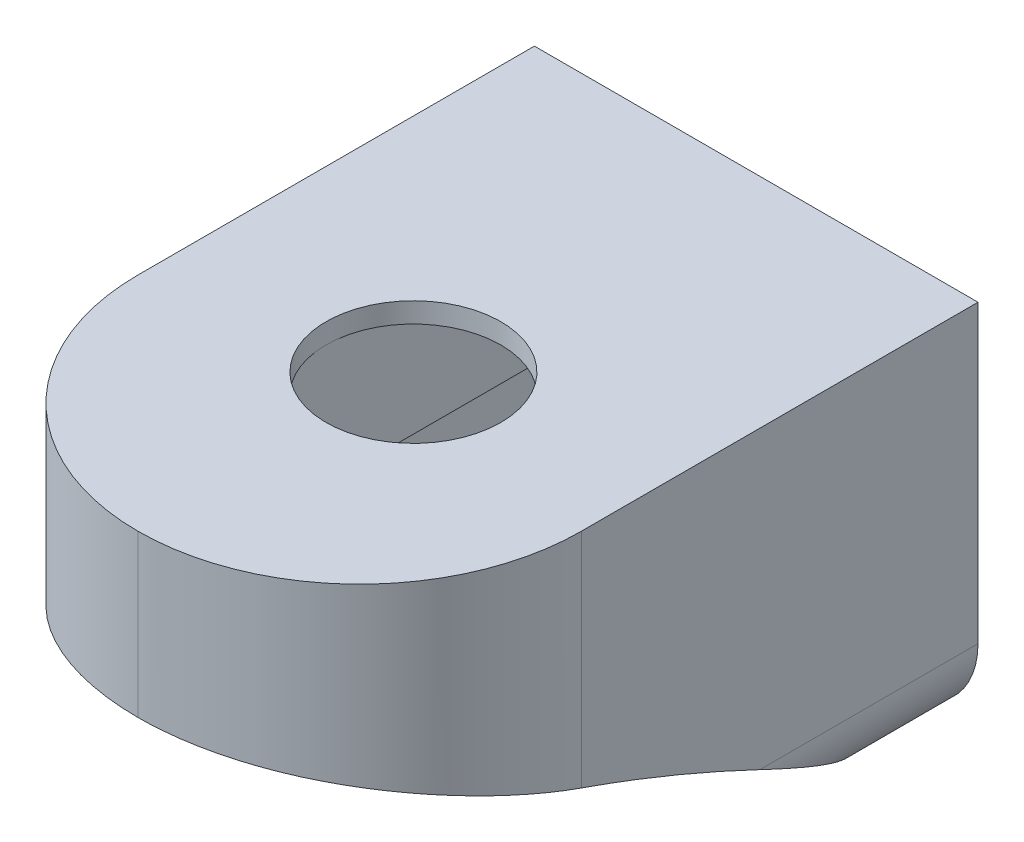
from build123d import *

# Parameters (mm, degrees)
SKETCH1_W           = 33
SKETCH1_H           = 28
BOSS_EXTRUDE1_DEPTH = 46
CUT_EXTRUDE1_DEPTH  = 59.318093247
CUT_EXTRUDE2_START  = -3
CUT_EXTRUDE2_DEPTH  = 27
FILLET1_R           = 12.5
FILLET2_R           = 16.5
FILLET3_R           = 6
SKETCH4_W           = 13
SKETCH4_H           = 23
CUT_EXTRUDE3_DEPTH  = 9
SKETCH5_R           = 6.5
CUT_EXTRUDE4_DEPTH  = 56.592265809
SKETCH6_R           = 1
CUT_EXTRUDE5_DEPTH  = 8
SKETCH7_R           = 1.3
SKETCH7_R_2         = 2.5
CUT_EXTRUDE6_DEPTH  = 2.5


with BuildPart() as part:
    # Sketch1 → Boss-Extrude1 (new body)
    with BuildSketch(Plane.XY):
        Rectangle(SKETCH1_W, SKETCH1_H)
    extrude(amount=BOSS_EXTRUDE1_DEPTH)

    # Sketch2 → Cut-Extrude1 (cut, through all)
    with BuildSketch(Plane(origin=(16.5, 0, 0), x_dir=(0, 0, -1), z_dir=(1, 0, 0))):
        with BuildLine():
            Line((-46, 2), (-46, -14))
            Line((-46, -14), (-5, -14))
            add(Edge.make_bspline(
                [(-5, -14), (-24.445807758, -2.434726237), (-46, 2)],
                knots=[0, 0, 0, 1, 1, 1], degree=2))
        make_face()
    extrude(amount=-CUT_EXTRUDE1_DEPTH, mode=Mode.SUBTRACT)

    # Sketch3 → Cut-Extrude2 (cut)
    with BuildSketch(Plane(origin=(16.5, 0, 0), x_dir=(0, 0, -1), z_dir=(1, 0, 0)).offset(CUT_EXTRUDE2_START)):
        with BuildLine():
            Line((-5, -14), (-2.5, -14))
            Line((-2.5, -14), (-2.5, 3.5))
            Line((-2.5, 3.5), (-40.5, 3.5))
            Line((-40.5, 3.5), (-40.5, 0.743693735))
            add(Edge.make_bspline(
                [(-5, -14), (-21.949128929, -3.919610512), (-40.5, 0.743693735)],
                knots=[0, 0, 0, 1, 1, 1], degree=2))
        make_face()
    extrude(amount=-CUT_EXTRUDE2_DEPTH, mode=Mode.SUBTRACT)

    # Fillet1
    fillet1_edges = [part.edges().sort_by_distance(p)[0] for p in [
        (13.5, 2.121846868, 40.5),
        (-13.5, 2.121846868, 40.5),
    ]]
    fillet(fillet1_edges, radius=FILLET1_R)

    # Fillet2
    fillet2_edges = [part.edges().sort_by_distance(p)[0] for p in [
        (16.5, 8, 46),
        (-16.5, 8, 46),
    ]]
    fillet(fillet2_edges, radius=FILLET2_R - 0.0001)  # a hair under: the kernel refuses the full size

    # Fillet3
    fillet3_edges = [part.edges().sort_by_distance(p)[0] for p in [
        (-16.5, -14, 2.5),
        (16.5, -14, 2.5),
    ]]
    fillet(fillet3_edges, radius=FILLET3_R)

    # Sketch4 → Cut-Extrude3 (cut)
    with BuildSketch(Plane.XZ.offset(-3.5)):
        with Locations((0, 20.5)):
            Rectangle(SKETCH4_W, SKETCH4_H)
    extrude(amount=-CUT_EXTRUDE3_DEPTH, mode=Mode.SUBTRACT)

    # Sketch5 → Cut-Extrude4 (cut, through all)
    with BuildSketch(Plane.XZ.offset(-12.5)):
        with Locations((0, 25.5)):
            Circle(SKETCH5_R)
    extrude(amount=-CUT_EXTRUDE4_DEPTH, mode=Mode.SUBTRACT)

    # Sketch6 → Cut-Extrude5 (cut)
    with BuildSketch(Plane.XZ.offset(-3.5)):
        with Locations((0, 34.3)):
            Circle(SKETCH6_R)
        with Locations((0, 6.7)):
            Circle(SKETCH6_R)
    extrude(amount=-CUT_EXTRUDE5_DEPTH, mode=Mode.SUBTRACT)

    # Sketch7 → Cut-Extrude6 (cut)
    with BuildSketch(Plane(origin=(0, 0, 0), x_dir=(-1, 0, 0), z_dir=(0, 0, -1))):
        with Locations((0.5, 0)):
            Circle(SKETCH7_R)
        with Locations((5, 0)):
            Circle(SKETCH7_R_2)
        with Locations((9.5, 0)):
            Circle(SKETCH7_R)
    extrude(amount=-CUT_EXTRUDE6_DEPTH, mode=Mode.SUBTRACT)


solid = part.part
